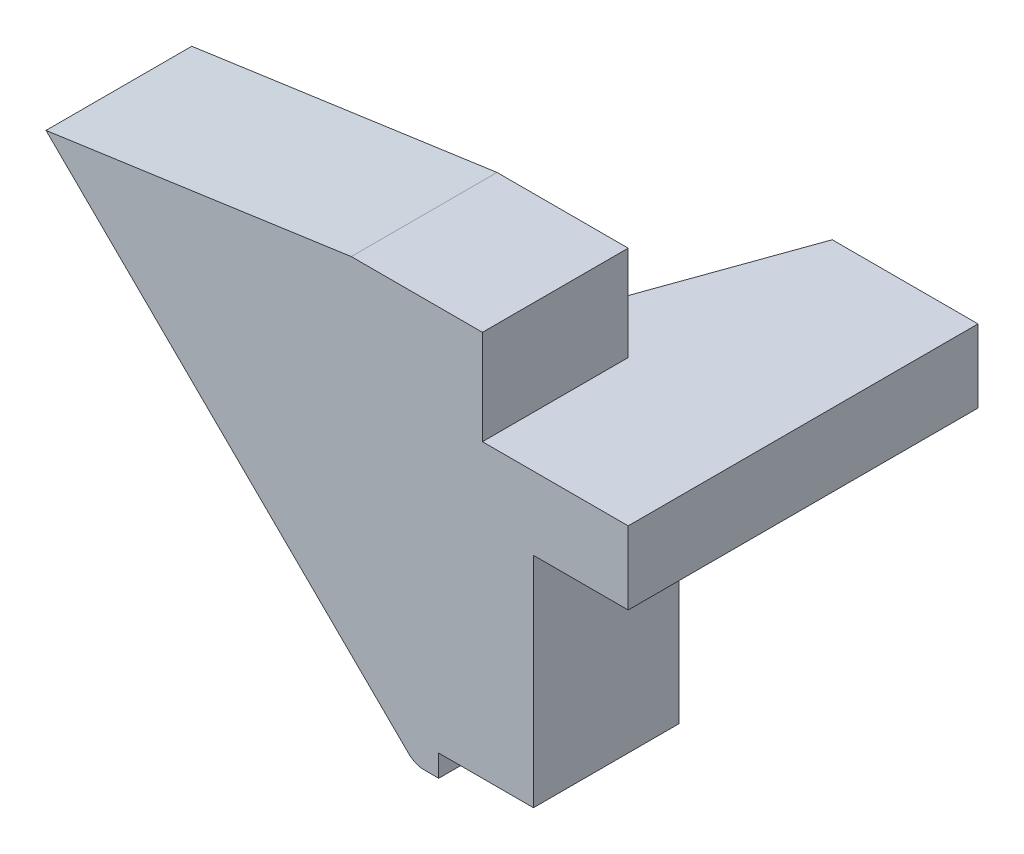
from build123d import *

# Parameters (mm, degrees)
EXTRUDE_1_DEPTH       = 172
SHELL_START           = 6
SHELL_1_DEPTH         = 160
SKETCH_2_W            = 36
SKETCH_2_H            = 16
CUT_EXTRUDE_1_DEPTH   = 74
EXTRUDE_2_DEPTH       = 2
SKETCH_4_R            = 10
CUT_EXTRUDE_2_DEPTH   = 186
SKETCH_5_R            = 1.5
CUT_EXTRUDE_3_DEPTH   = 10
EXTRUDE_3_DEPTH       = 172
SKETCH_7_W            = 36
SKETCH_7_H            = 16
CUT_EXTRUDE_4_DEPTH   = 172
SKETCH_8_W            = 6
SKETCH_8_H            = 172
CUT_EXTRUDE_5_DEPTH   = 3
EXTRUDE_4_DEPTH       = 15
CHAMFER_1_SIZE        = 15
CHAMFER_2_SIZE        = 15
CHAMFER_3_SIZE        = 8
SKETCH_10_R           = 1.35
CUT_EXTRUDE_6_DEPTH   = 15
SKETCH_12_R           = 1.35
CUT_EXTRUDE_7_DEPTH   = 15
SKETCH_14_OUTSIDE_W   = 213.548
SKETCH_14_OUTSIDE_H   = 97.548
SKETCH_14_OUTSIDE_W_2 = 15
SKETCH_14_OUTSIDE_H_2 = 56
CUT_EXTRUDE_8_DEPTH   = 82.5
EXTRUDE_5_DEPTH       = 15
CUT_EXTRUDE_9_DEPTH   = 15
SKETCH_17_W           = 13
SKETCH_17_H           = 5
EXTRUDE_6_DEPTH       = 15
EXTRUDE_7_DEPTH       = 20
SHELL_START_2         = 78.159554327
SHELL_2_DEPTH         = 10
EXTRUDE_8_DEPTH       = 28
CUT_EXTRUDE_10_DEPTH  = 20
CUT_EXTRUDE_11_DEPTH  = 20
CUT_EXTRUDE_12_DEPTH  = 63


# Read off the part's stored shape, not the designer's step: 抽壳1, 抽壳2
with BuildPart() as part:
    # 草图1 → 凸台-拉伸1 (new body)
    with BuildSketch(Plane.XY):
        with BuildLine():
            Line((0, 0), (0, 40))
            Line((0, 40), (-5, 40))
            Line((-5, 40), (-5, 53))
            Line((-5, 53), (-23, 53))
            Line((-23, 53), (-64.888578151, 47.050698608))
            Line((-64.888578151, 47.050698608), (-15.121320344, -2.121320344))
            ThreePointArc((-15.121320344, -2.121320344), (-14.148050297, -2.771638598), (-13, -3))
            Line((-13, -3), (-5, -3))
            Line((-5, -3), (-5, 0))
            Line((-5, 0), (0, 0))
        make_face()
    extrude(amount=EXTRUDE_1_DEPTH)

    # 抽壳1 outline → 抽壳1 (cut)
    with BuildSketch(Plane.XY.offset(SHELL_START)):
        Polygon((-11, 6), (-6, 6), (-6, 34), (-11, 34), (-11, 47), (-22.576046832, 47), (-52.061983815, 42.812206246), (-11.767841448, 3), (-11, 3), align=None)
    extrude(amount=SHELL_1_DEPTH, mode=Mode.SUBTRACT)

    # 草图2 → 切除-拉伸1 (cut)
    with BuildSketch(Plane(origin=(0, 0, 0), x_dir=(0, 0, -1), z_dir=(1, 0, 0))):
        with Locations((-136, 10)):
            Rectangle(SKETCH_2_W, SKETCH_2_H)
        with Locations((-36, 10)):
            Rectangle(SKETCH_2_W, SKETCH_2_H)
    extrude(amount=-CUT_EXTRUDE_1_DEPTH, mode=Mode.SUBTRACT)

    # 草图3 → 凸台-拉伸2 (add, symmetric)
    with BuildSketch(Plane(origin=(0, 0, 86), x_dir=(-1, 0, 0), z_dir=(0, 0, -1))):
        Polygon((5, 53), (5, 40), (0, 40), (0, 0), (5, 0), (5, -3), (13, -3), (16.579355858, -0.680723591), (64.888578151, 47.050698608), (23, 53), align=None)
    extrude(amount=EXTRUDE_2_DEPTH, both=True)

    # 草图4 → 切除-拉伸2 (cut)
    with BuildSketch(Plane.XY.offset(172)):
        with Locations((-15, 21.071297481)):
            Circle(SKETCH_4_R)
    extrude(amount=-CUT_EXTRUDE_2_DEPTH, mode=Mode.SUBTRACT)

    # 草图5 → 切除-拉伸3 (cut)
    with BuildSketch(Plane(origin=(0, 53, 0), x_dir=(1, 0, 0), z_dir=(0, 1, 0))):
        with Locations(Location((-13.338195438, -63.5, 0), (0, 0, 270))):
            Circle(SKETCH_5_R)
        with Locations(Location((-13.338195438, -108.5, 0), (0, 0, 270))):
            Circle(SKETCH_5_R)
    extrude(amount=-CUT_EXTRUDE_3_DEPTH, mode=Mode.SUBTRACT)

    # 草图6 → 凸台-拉伸3 (add)
    with BuildSketch(Plane.XY.offset(172)):
        Polygon((-11, 6), (-14.804157153, 6), (-11.767841448, 3), (-11, 3), align=None)
    extrude(amount=-EXTRUDE_3_DEPTH)

    # 草图7 → 切除-拉伸4 (cut)
    with BuildSketch(Plane(origin=(0, 0, 0), x_dir=(0, 0, -1), z_dir=(1, 0, 0))):
        with Locations((-136, 10)):
            Rectangle(SKETCH_7_W, SKETCH_7_H)
        with Locations((-36, 10)):
            Rectangle(SKETCH_7_W, SKETCH_7_H)
    extrude(amount=-CUT_EXTRUDE_4_DEPTH, mode=Mode.SUBTRACT)

    # 草图8 → 切除-拉伸5 (cut)
    with BuildSketch(Plane.XZ.offset(3)):
        with Locations((-8, 86)):
            Rectangle(SKETCH_8_W, SKETCH_8_H)
    extrude(amount=-CUT_EXTRUDE_5_DEPTH, mode=Mode.SUBTRACT)

    # 草图9 → 凸台-拉伸4 (add)
    with BuildSketch(Plane(origin=(0, 0, 0), x_dir=(0, 0, -1), z_dir=(1, 0, 0))):
        Polygon((-86, 40), (-151, 40), (-151, 35), (-86, 35), (-21, 35), (-21, 40), align=None)
    extrude(amount=EXTRUDE_4_DEPTH)

    # 倒角1
    chamfer_1_edges = [part.edges().sort_by_distance(p)[0] for p in [
        (15, 37.5, 151),
    ]]
    chamfer(chamfer_1_edges, length=CHAMFER_1_SIZE - 0.0001)  # a hair under: the kernel refuses the full size

    # 倒角2
    chamfer_2_edges = [part.edges().sort_by_distance(p)[0] for p in [
        (15, 37.5, 21),
    ]]
    chamfer(chamfer_2_edges, length=CHAMFER_2_SIZE - 0.0001)  # a hair under: the kernel refuses the full size

    # 倒角3
    chamfer_3_edges = [part.edges().sort_by_distance(p)[0] for p in [
        (0, 35, 86),
    ]]
    chamfer(chamfer_3_edges, length=CHAMFER_3_SIZE)

    # 草图10 → 切除-拉伸6 (cut)
    with BuildSketch(Plane.XZ):
        with Locations((-5, 158)):
            Circle(SKETCH_10_R)
        with Locations((-5, 111)):
            Circle(SKETCH_10_R)
        with Locations((-5, 61)):
            Circle(SKETCH_10_R)
        with Locations((-5, 14.01360213)):
            Circle(SKETCH_10_R)
    extrude(amount=-CUT_EXTRUDE_6_DEPTH, mode=Mode.SUBTRACT)

    # 草图12 → 切除-拉伸7 (cut)
    with BuildSketch(Plane(origin=(0, 40, 0), x_dir=(1, 0, 0), z_dir=(0, 1, 0))):
        with Locations(Location((5, -41, 0), (0, 0, 270))):
            Circle(SKETCH_12_R)
        with Locations(Location((5, -86, 0), (0, 0, 270))):
            Circle(SKETCH_12_R)
        with Locations(Location((5, -131, 0), (0, 0, 270))):
            Circle(SKETCH_12_R)
    extrude(amount=-CUT_EXTRUDE_7_DEPTH, mode=Mode.SUBTRACT)

    # 草图14 outside → 切除-拉伸8 (cut, symmetric)
    with BuildSketch(Plane(origin=(0, 0, 0), x_dir=(0, 0, -1), z_dir=(1, 0, 0))):
        with Locations((-86, 25)):
            Rectangle(SKETCH_14_OUTSIDE_W, SKETCH_14_OUTSIDE_H)
        with Locations((-75.659554327, 25)):
            Rectangle(SKETCH_14_OUTSIDE_W_2, SKETCH_14_OUTSIDE_H_2, mode=Mode.SUBTRACT)
    extrude(amount=CUT_EXTRUDE_8_DEPTH, both=True, mode=Mode.SUBTRACT)

    # 草图15 → 凸台-拉伸5 (add)
    with BuildSketch(Plane(origin=(0, 0, 68.159554327), x_dir=(-1, 0, 0), z_dir=(0, 0, -1))):
        Polygon((0, 0), (-2, 0), (-2, 29), (0, 27), align=None)
    extrude(amount=-EXTRUDE_5_DEPTH)

    # 草图16 → 切除-拉伸9 (cut)
    with BuildSketch(Plane(origin=(0, 0, 68.159554327), x_dir=(-1, 0, 0), z_dir=(0, 0, -1))):
        Polygon((-2, 29), (-2, 35), (-8, 35), align=None)
    extrude(amount=-CUT_EXTRUDE_9_DEPTH, mode=Mode.SUBTRACT)

    # 草图17 → 凸台-拉伸6 (add)
    with BuildSketch(Plane(origin=(0, 0, 68.159554327), x_dir=(-1, 0, 0), z_dir=(0, 0, -1))):
        with Locations((-8.5, 32.5)):
            Rectangle(SKETCH_17_W, SKETCH_17_H)
    extrude(amount=-EXTRUDE_6_DEPTH)

    # 草图18 → 凸台-拉伸7 (add)
    with BuildSketch(Plane(origin=(0, 0, 68.159554327), x_dir=(-1, 0, 0), z_dir=(0, 0, -1))):
        with BuildLine():
            Line((-15, 40), (-15, 30))
            Line((-15, 30), (-2, 30))
            Line((-2, 30), (-2, 0))
            Line((-2, 0), (11, 0))
            Line((11, 0), (11, -3))
            Line((11, -3), (13, -3))
            ThreePointArc((13, -3), (14.148050297, -2.771638598), (15.121320344, -2.121320344))
            Line((15.121320344, -2.121320344), (64.888578151, 47.050698608))
            Line((64.888578151, 47.050698608), (23, 53))
            Line((23, 53), (5, 53))
            Line((5, 53), (5, 40))
            Line((5, 40), (-15, 40))
        make_face()
    extrude(amount=-EXTRUDE_7_DEPTH)

    # 抽壳2 outline → 抽壳2 (cut)
    with BuildSketch(Plane.XY.offset(SHELL_START_2)):
        Polygon((-8, 30), (-15, 30), (-15, 43), (-22.293411387, 43), (-43.510920925, 39.986544671), (-13.161382076, 10), (-8, 10), align=None)
    extrude(amount=SHELL_2_DEPTH, mode=Mode.SUBTRACT)

    # 草图20 → 凸台-拉伸8 (add)
    with BuildSketch(Plane.XY.offset(88.159554327)):
        Polygon((15, 40), (-15, 40), (-15, 30), (-8, 30), (-8, 22), (2, 22), (2, 30), (15, 30), align=None)
    extrude(amount=EXTRUDE_8_DEPTH)

    # 草图21 → 切除-拉伸10 (cut)
    with BuildSketch(Plane(origin=(2, 0, 0), x_dir=(0, 0, -1), z_dir=(1, 0, 0))):
        Polygon((-116.159554327, 30), (-88.159554327, 22), (-116.159554327, 22), align=None)
    extrude(amount=-CUT_EXTRUDE_10_DEPTH, mode=Mode.SUBTRACT)

    # 草图22 → 切除-拉伸11 (cut)
    with BuildSketch(Plane(origin=(0, 40, 0), x_dir=(1, 0, 0), z_dir=(0, 1, 0))):
        Polygon((-8, -116.159554327), (-15, -116.159554327), (-15, -88.159554327), (-5, -116.159554327), align=None)
    extrude(amount=-CUT_EXTRUDE_11_DEPTH, mode=Mode.SUBTRACT)


with BuildPart() as body_2:
    # 镜向6: mirrored copy
    add(part.part.mirror(Plane.XY.offset(126.159554327)))


with BuildPart() as part_1:
    add(part.part)

    # 草图24 → 切除-拉伸12 (cut, symmetric)
    with BuildSketch(Plane(origin=(0, 40, 0), x_dir=(1, 0, 0), z_dir=(0, 1, 0))):
        Polygon((-102.39415219, -125.726561749), (32.776263332, -125.726561749), (42.64807393, -30.561512846), (-60.072475676, -35.644094183), align=None)
    extrude(amount=CUT_EXTRUDE_12_DEPTH, both=True, mode=Mode.SUBTRACT)


solid = body_2.part
